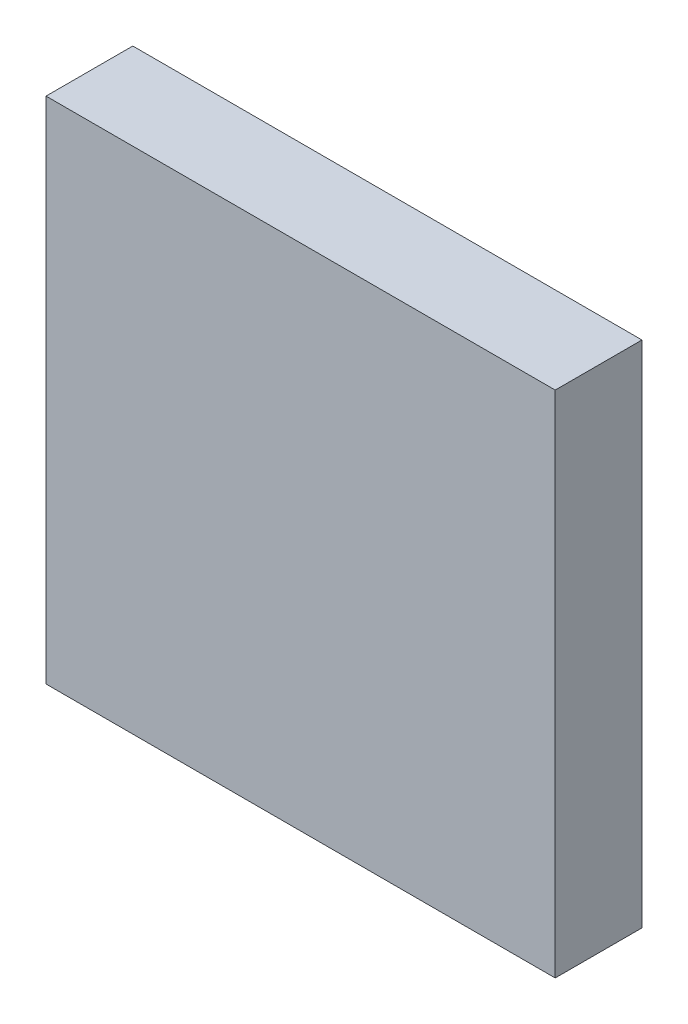
from build123d import *

# Parameters (mm, degrees)
SKIZZE1_W                       = 135
SKIZZE1_H                       = 135
SKIZZE1_W_2                     = 131
SKIZZE1_H_2                     = 131
AUFSATZ_LINEAR_AUSTRAGEN1_DEPTH = 18
SKIZZE2_W                       = 135
SKIZZE2_H                       = 135
AUFSATZ_LINEAR_AUSTRAGEN2_DEPTH = 5


with BuildPart() as part:
    # Skizze1 → Aufsatz-Linear austragen1 (new body)
    with BuildSketch(Plane.XY):
        Rectangle(SKIZZE1_W, SKIZZE1_H)
        Rectangle(SKIZZE1_W_2, SKIZZE1_H_2, mode=Mode.SUBTRACT)
    extrude(amount=AUFSATZ_LINEAR_AUSTRAGEN1_DEPTH)

    # Skizze2 → Aufsatz-Linear austragen2 (add)
    with BuildSketch(Plane.XY.offset(18)):
        Rectangle(SKIZZE2_W, SKIZZE2_H)
    extrude(amount=AUFSATZ_LINEAR_AUSTRAGEN2_DEPTH)


solid = part.part
